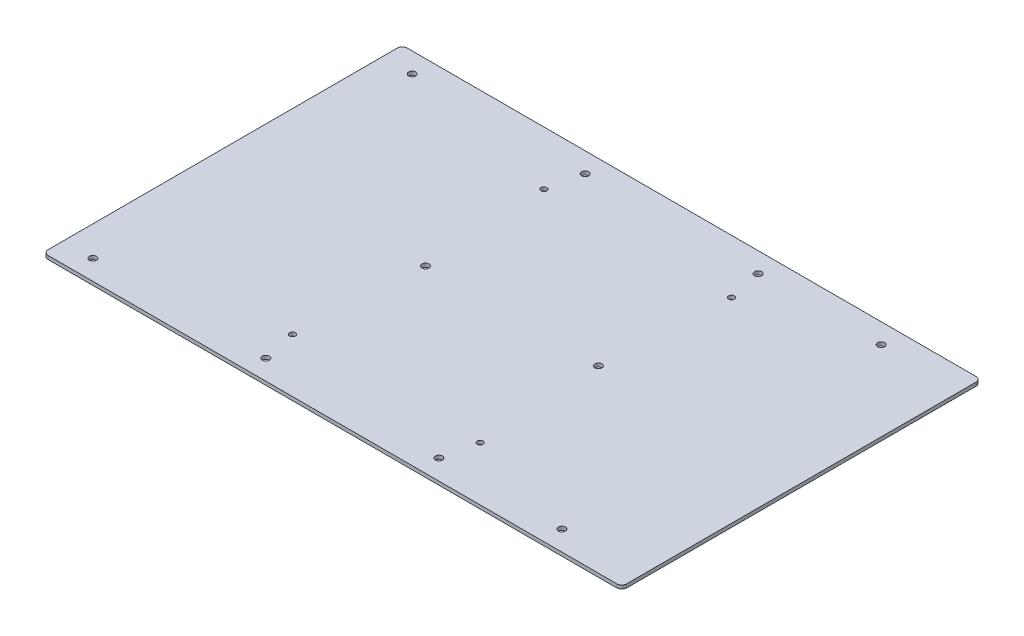
from build123d import *

# Parameters (mm, degrees)
SKETCH1_R           = 2.2479
SKETCH1_R_2         = 1.8288
BOSS_EXTRUDE1_DEPTH = 2.286


with BuildPart() as part:
    # Sketch1 → Boss-Extrude1 (new body)
    with BuildSketch(Plane(origin=(0, 0, 0), x_dir=(1, 0, 0), z_dir=(0, 1, 0))):
        with BuildLine():
            Line((-180.975, 114.3), (180.975, 114.3))
            ThreePointArc((180.975, 114.3), (183.22006403, 113.37006403), (184.15, 111.125))
            Line((184.15, 111.125), (184.15, -111.125))
            ThreePointArc((184.15, -111.125), (183.22006403, -113.37006403), (180.975, -114.3))
            Line((180.975, -114.3), (-180.975, -114.3))
            ThreePointArc((-180.975, -114.3), (-183.22006403, -113.37006403), (-184.15, -111.125))
            Line((-184.15, -111.125), (-184.15, 111.125))
            ThreePointArc((-184.15, 111.125), (-183.22006403, 113.37006403), (-180.975, 114.3))
        make_face()
        with Locations((-165.1, 101.6)):
            Circle(SKETCH1_R, mode=Mode.SUBTRACT)
        with Locations((-55.033333333, 101.6)):
            Circle(SKETCH1_R, mode=Mode.SUBTRACT)
        with Locations((55.033333333, 101.6)):
            Circle(SKETCH1_R, mode=Mode.SUBTRACT)
        with Locations((55.033333333, -101.6)):
            Circle(SKETCH1_R, mode=Mode.SUBTRACT)
        with Locations((-55.033333333, -101.6)):
            Circle(SKETCH1_R, mode=Mode.SUBTRACT)
        with Locations((-165.1, -101.6)):
            Circle(SKETCH1_R, mode=Mode.SUBTRACT)
        with Locations((-55.033333333, 0)):
            Circle(SKETCH1_R, mode=Mode.SUBTRACT)
        with Locations((55.033333333, 0)):
            Circle(SKETCH1_R, mode=Mode.SUBTRACT)
        with Locations((133.35, -101.6)):
            Circle(SKETCH1_R, mode=Mode.SUBTRACT)
        with Locations((133.35, 101.6)):
            Circle(SKETCH1_R, mode=Mode.SUBTRACT)
        with Locations((59.69, -80.01)):
            Circle(SKETCH1_R_2, mode=Mode.SUBTRACT)
        with Locations((-59.69, -80.01)):
            Circle(SKETCH1_R_2, mode=Mode.SUBTRACT)
        with Locations((-59.69, 80.01)):
            Circle(SKETCH1_R_2, mode=Mode.SUBTRACT)
        with Locations((59.69, 80.01)):
            Circle(SKETCH1_R_2, mode=Mode.SUBTRACT)
    extrude(amount=BOSS_EXTRUDE1_DEPTH)


solid = part.part
